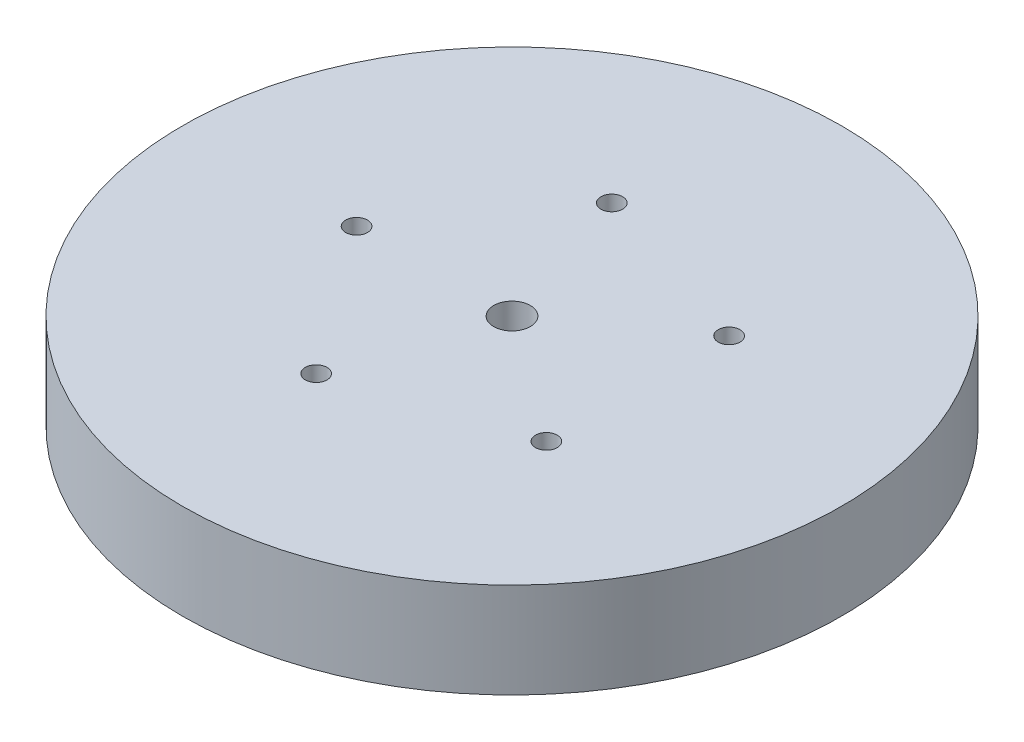
from build123d import *

# Parameters (mm, degrees)
SKETCH1_R           = 90
BOSS_EXTRUDE1_DEPTH = 26
SKETCH2_R           = 5
CUT_EXTRUDE1_DEPTH  = 130.907659512
SKETCH3_R           = 2.967721001
CUT_EXTRUDE2_DEPTH  = 21.490492961
CIRPATTERN1_COUNT   = 5


with BuildPart() as part:
    # Sketch1 → Boss-Extrude1 (new body)
    with BuildSketch(Plane(origin=(0, 0, 0), x_dir=(1, 0, 0), z_dir=(0, 1, 0))):
        Circle(SKETCH1_R)
    extrude(amount=BOSS_EXTRUDE1_DEPTH)

    # Sketch2 → Cut-Extrude1 (cut, through all)
    with BuildSketch(Plane(origin=(0, 0, 0), x_dir=(1, 0, 0), z_dir=(0, 1, 0))):
        Circle(SKETCH2_R)
    extrude(amount=CUT_EXTRUDE1_DEPTH, mode=Mode.SUBTRACT)

    # Sketch3 → Cut-Extrude2 (cut)
    with BuildSketch(Plane(origin=(0, 26, 0), x_dir=(1, 0, 0), z_dir=(0, 1, 0))):
        with Locations((-42.444174313, 0)):
            Circle(SKETCH3_R)
    cut_extrude2 = extrude(amount=-CUT_EXTRUDE2_DEPTH, mode=Mode.SUBTRACT)

    # CirPattern1: Cut-Extrude2 ×5 about axis
    cirpattern1_axis = Axis((0, 0, 0), (0, 1, 0))
    for i in range(1, CIRPATTERN1_COUNT):
        add(cut_extrude2.rotate(cirpattern1_axis, i * 360 / CIRPATTERN1_COUNT), mode=Mode.SUBTRACT)


solid = part.part
